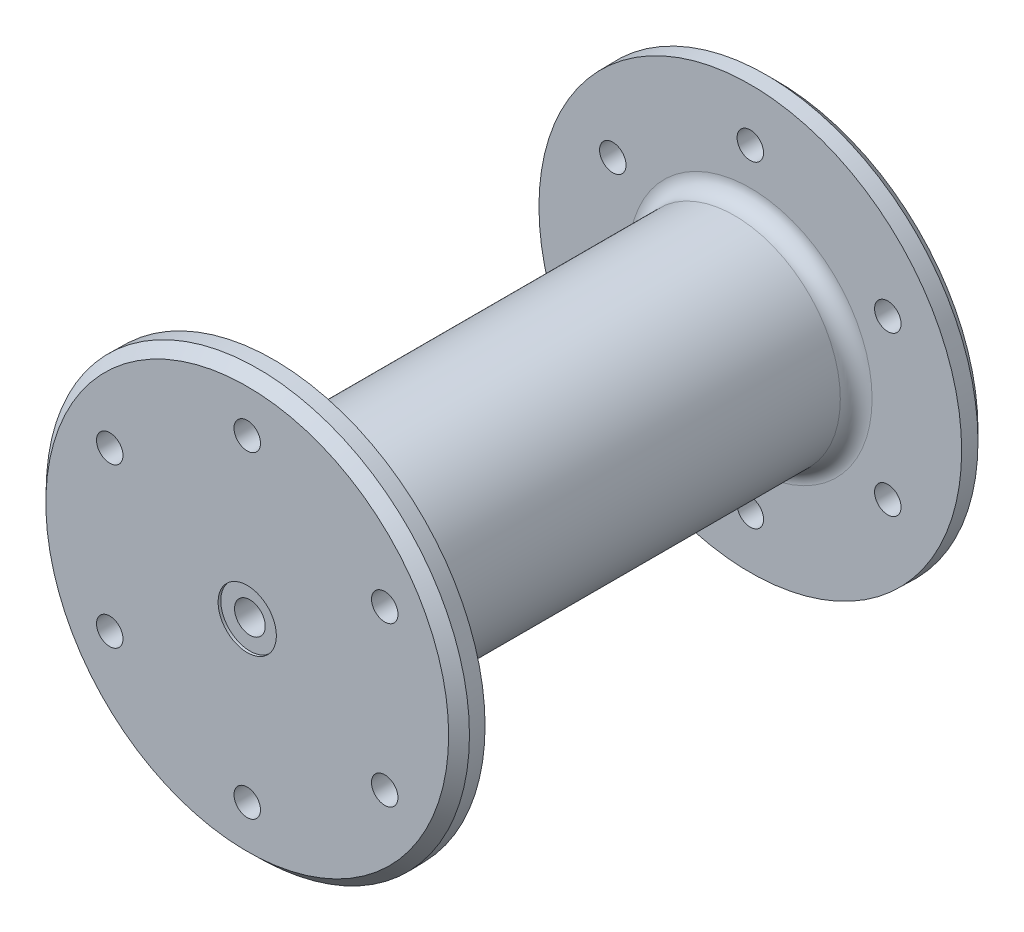
from build123d import *

# Parameters (mm, degrees)
SKETCH1_R                               = 20
BOSS_EXTRUDE1_DEPTH                     = 50
SKETCH2_R                               = 40
BOSS_EXTRUDE2_DEPTH                     = 5
BOSS_EXTRUDE2_DRAFT                     = -1
CHAMFER1_SIZE                           = 2
CHAMFER1_SIZE2                          = 1.965988204
SKETCH3_R                               = 2.5
CUT_EXTRUDE1_DEPTH                      = 115.866956374
CIRPATTERN1_COUNT                       = 6
FILLET1_R                               = 3
CBORE_FOR_M5_HEX_HEAD_BOLT1_D           = 5.8
CBORE_FOR_M5_HEX_HEAD_BOLT1_CBORE_D     = 11
CBORE_FOR_M5_HEX_HEAD_BOLT1_CBORE_DEPTH = 0.5
MIRROR1_START                           = -50
MIRROR1_OUTLINE_R                       = 5.5
MIRROR1_DEPTH                           = 0.5
MIRROR1_3_OUTLINE_R                     = 2.5
MIRROR1_3_DEPTH                         = 5


with BuildPart() as part:
    # Sketch1 → Boss-Extrude1 (new, symmetric)
    with BuildSketch(Plane.XY):
        Circle(SKETCH1_R)
    extrude(amount=BOSS_EXTRUDE1_DEPTH, both=True)


with BuildPart() as boss_extrude2_tool:
    # Sketch2 → Boss-Extrude2 (with draft: the straight prism first)
    with BuildSketch(Plane.XY.offset(50)):
        Circle(SKETCH2_R)
    extrude(amount=-BOSS_EXTRUDE2_DEPTH)
    # Boss-Extrude2: the draft: its side faces are tilted about the plane it starts from
    boss_extrude2_sides = [boss_extrude2_tool.faces().sort_by_distance(p)[0] for p in [
        (-40, 0, 47.5),
    ]]
    draft(boss_extrude2_sides, Plane.XY.offset(50), BOSS_EXTRUDE2_DRAFT)


with BuildPart() as part_1:
    add(part.part)

    # Boss-Extrude2: add boss_extrude2_tool
    add(boss_extrude2_tool.part)

    # Chamfer1
    chamfer1_edges = [part_1.edges().sort_by_distance(p)[0] for p in [
        (-40, 0, 50),
    ]]
    chamfer1_side = [part_1.faces().sort_by_distance(p)[0] for p in [
        (-39.956362338, 0, 47.5),
    ]]
    chamfer(chamfer1_edges, length=CHAMFER1_SIZE, length2=CHAMFER1_SIZE2, reference=chamfer1_side[0])

    # Sketch3 → Cut-Extrude1 (cut, through all)
    with BuildSketch(Plane.XY.offset(50)):
        with Locations((0, 29.982547594)):
            Circle(SKETCH3_R)
    cut_extrude1 = extrude(amount=-CUT_EXTRUDE1_DEPTH, mode=Mode.SUBTRACT)

    # CirPattern1: Cut-Extrude1 ×6 about axis
    cirpattern1_axis = Axis((0, 0, 0), (0, 0, 1))
    for i in range(1, CIRPATTERN1_COUNT):
        add(cut_extrude1.rotate(cirpattern1_axis, i * 360 / CIRPATTERN1_COUNT), mode=Mode.SUBTRACT)

    # Fillet1
    fillet1_edges = [part_1.edges().sort_by_distance(p)[0] for p in [
        (-20, 0, 45),
    ]]
    fillet(fillet1_edges, radius=FILLET1_R)

    # CBORE for M5 Hex Head Bolt1 (through all)
    with Locations(Plane.XY.offset(50)):
        with Locations((0, 0)):
            CounterBoreHole(CBORE_FOR_M5_HEX_HEAD_BOLT1_D / 2, CBORE_FOR_M5_HEX_HEAD_BOLT1_CBORE_D / 2, CBORE_FOR_M5_HEX_HEAD_BOLT1_CBORE_DEPTH)

    # Mirror1: read off the stored shape, not the designer's step
    # Mirror1 outline → Mirror1 (cut)
    with BuildSketch(Plane.XY.offset(MIRROR1_START)):
        Circle(MIRROR1_OUTLINE_R)
    extrude(amount=MIRROR1_DEPTH, mode=Mode.SUBTRACT)

    # Mirror1 2 outline → Mirror1 2 (revolve)
    with BuildSketch(Plane.XZ):
        with BuildLine():
            Line((38, -50), (39.965688775, -48.034311225))
            Line((39.965688775, -48.034311225), (39.912724675, -45))
            Line((39.912724675, -45), (23, -45))
            ThreePointArc((23, -45), (20.878679656, -44.121320344), (20, -42))
            Line((20, -42), (20, -50))
            Line((20, -50), (38, -50))
        make_face()
    revolve(axis=Axis((0, 0, 0), (0, 0, 1)))

    # Mirror1 3 outline → Mirror1 3 (cut)
    with BuildSketch(Plane.XY.offset(MIRROR1_START)):
        with Locations((0, 29.982547594)):
            Circle(MIRROR1_3_OUTLINE_R)
        with Locations((25.965647886, 14.991273797)):
            Circle(MIRROR1_3_OUTLINE_R)
        with Locations((25.965647886, -14.991273797)):
            Circle(MIRROR1_3_OUTLINE_R)
        with Locations((0, -29.982547594)):
            Circle(MIRROR1_3_OUTLINE_R)
        with Locations((-25.965647886, -14.991273797)):
            Circle(MIRROR1_3_OUTLINE_R)
        with Locations((-25.965647886, 14.991273797)):
            Circle(MIRROR1_3_OUTLINE_R)
    extrude(amount=MIRROR1_3_DEPTH, mode=Mode.SUBTRACT)


solid = part_1.part
